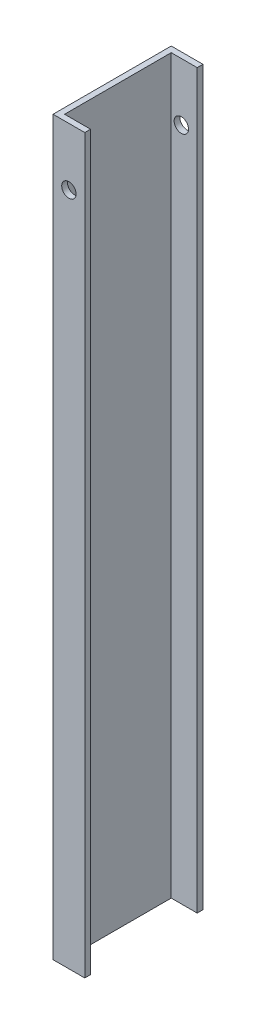
from build123d import *

# Parameters (mm, degrees)
BOSS_EXTRUDE1_DEPTH = 254
SKETCH2_R           = 2.5
CUT_EXTRUDE1_DEPTH  = 258.522814523


with BuildPart() as part:
    # Sketch1 → Boss-Extrude1 (new body)
    with BuildSketch(Plane(origin=(0, 0, 0), x_dir=(1, 0, 0), z_dir=(0, 1, 0))):
        Polygon((0, 0), (0, 41), (11, 41), (11, 39), (2, 39), (2, 2), (11, 2), (11, 0), align=None)
    extrude(amount=BOSS_EXTRUDE1_DEPTH)

    # Sketch2 → Cut-Extrude1 (cut, through all)
    with BuildSketch(Plane.XY):
        with Locations((5.5, 234)):
            Circle(SKETCH2_R)
    extrude(amount=-CUT_EXTRUDE1_DEPTH, mode=Mode.SUBTRACT)


solid = part.part
